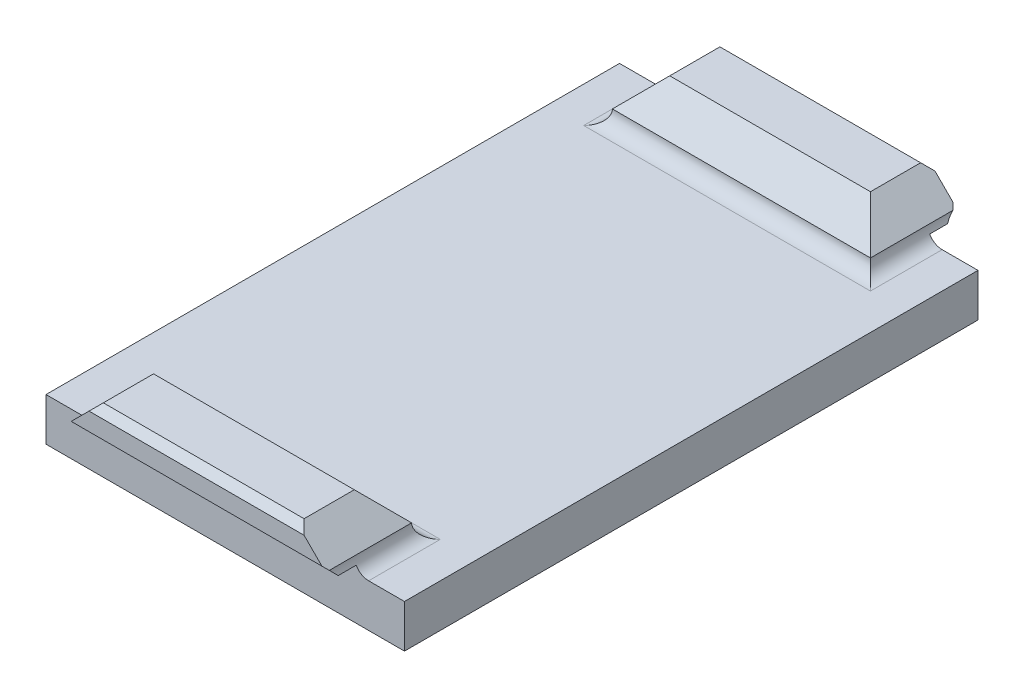
from build123d import *

# Parameters (mm, degrees)
SKETCH_1_W      = 25
SKETCH_1_H      = 3
EXTRUDE_1_DEPTH = 20
SKETCH_2_W      = 18
SKETCH_2_H      = 4
EXTRUDE_2_DEPTH = 3
EXTRUDE_3_DEPTH = 2
CHAMFER_1_SIZE  = 0.75
CHAMFER_2_SIZE  = 0.5
CHAMFER_3_SIZE  = 2
CHAMFER1_SIZE   = 2
FILLET1_R       = 1


with BuildPart() as part:
    # Эскиз1 → Бобышка-Вытянуть1 (new body)
    with BuildSketch(Plane.XY):
        with Locations((-4.579529598, 16.89)):
            Rectangle(SKETCH_1_W, SKETCH_1_H)
    extrude(amount=EXTRUDE_1_DEPTH)

    # Эскиз2 → Бобышка-Вытянуть2 (add)
    with BuildSketch(Plane(origin=(0, 18.39, 0), x_dir=(1, 0, 0), z_dir=(0, 1, 0))):
        with Locations((-4.579529598, -2)):
            Rectangle(SKETCH_2_W, SKETCH_2_H)
    extrude(amount=EXTRUDE_2_DEPTH)

    # Эскиз3 → Бобышка-Вытянуть3 (add)
    with BuildSketch(Plane(origin=(0, 0, 0), x_dir=(-1, 0, 0), z_dir=(0, 0, -1))):
        Polygon((-4.420470402, 21.39), (13.579529598, 21.39), (13.579529598, 19.89), (13.579529598, 18.896471803), (-4.420470402, 18.896471803), (-4.420470402, 19.89), align=None)
    extrude(amount=EXTRUDE_3_DEPTH)

    # Фаска1
    chamfer_1_edges = [part.edges().sort_by_distance(p)[0] for p in [
        (-4.579529598, 18.896471803, -2),
    ]]
    chamfer(chamfer_1_edges, length=CHAMFER_1_SIZE)

    # Фаска2
    chamfer_2_edges = [part.edges().sort_by_distance(p)[0] for p in [
        (-4.579529598, 21.39, -2),
    ]]
    chamfer(chamfer_2_edges, length=CHAMFER_2_SIZE)

    # Фаска3
    chamfer_3_edges = [part.edges().sort_by_distance(p)[0] for p in [
        (-4.579529598, 21.39, 4),
    ]]
    chamfer(chamfer_3_edges, length=CHAMFER_3_SIZE)

    # Зеркальное отражение1: part across plane


with BuildPart() as part_1:
    add(part.part)
    add(part.part.mirror(Plane.XY.offset(20)))

    # Chamfer1
    chamfer1_edges = [part_1.edges().sort_by_distance(p)[0] for p in [
        (4.420470402, 21.39, 39.75),
        (-13.579529598, 21.39, 39.75),
        (4.420470402, 21.39, 0.25),
        (-13.579529598, 21.39, 0.25),
    ]]
    chamfer(chamfer1_edges, length=CHAMFER1_SIZE)

    # Fillet1
    # the kernel refuses this fillet: 1 mm, written as the material it adds along each edge
    with BuildSketch(Plane(origin=(-13.579529598, 18.39, 6.5), x_dir=(-1, 0, 0), z_dir=(0, 0, -1))) as fillet1_piece_1_section:
        with BuildLine():
            CenterArc((FILLET1_R, FILLET1_R), FILLET1_R, 180, 90)
            Line((0, FILLET1_R), (0, 0))
            Line((0, 0), (FILLET1_R, 0))
        make_face()
    fillet1_piece_1 = extrude(amount=6.5, mode=Mode.PRIVATE)
    fillet1_piece_1 = split(fillet1_piece_1, bisect_by=Plane(origin=(-13.579529598, 17.64, 5.75), z_dir=(0, -0.7071067811865476, -0.7071067811865476)), keep=Keep.TOP, mode=Mode.PRIVATE)
    fillet1_piece_1 = fillet1_piece_1 - Plane(origin=(-13.579529598, 19.39, 5), x_dir=(0, 0, -1), z_dir=(1, 0, 0)) * Cylinder(1, 17, mode=Mode.PRIVATE)
    add(fillet1_piece_1)
    with BuildSketch(Plane(origin=(-13.579529598, 18.39, 6.5), x_dir=(-1, 0, 0), z_dir=(0, 0, -1))) as fillet1_piece_2_section:
        with BuildLine():
            CenterArc((FILLET1_R, FILLET1_R), FILLET1_R, 180, 90)
            Line((0, FILLET1_R), (0, 0))
            Line((0, 0), (FILLET1_R, 0))
        make_face()
    fillet1_piece_2 = extrude(amount=9, mode=Mode.PRIVATE)
    fillet1_piece_2 = split(fillet1_piece_2, bisect_by=Plane(origin=(-13.579529598, 14.768235901, 2.878235901), z_dir=(0, 0.7071067811865476, 0.7071067811865476)), keep=Keep.TOP, mode=Mode.PRIVATE)
    fillet1_piece_2 = split(fillet1_piece_2, bisect_by=Plane(origin=(-13.579529598, 18.896471803, 6.5), z_dir=(0, 1, 0)), keep=Keep.TOP, mode=Mode.PRIVATE)
    fillet1_piece_2 = split(fillet1_piece_2, bisect_by=Plane(origin=(-13.579529598, 18.39, 0), z_dir=(0, 0, -1)), keep=Keep.TOP, mode=Mode.PRIVATE)
    add(fillet1_piece_2)
    with BuildSketch(Plane(origin=(6.920470402, 18.39, 4), x_dir=(0, 1, 0), z_dir=(-1, 0, 0))) as fillet1_piece_3_section:
        with BuildLine():
            CenterArc((FILLET1_R, -FILLET1_R), FILLET1_R, 90, 90)
            Line((0, -FILLET1_R), (0, 0))
            Line((0, 0), (FILLET1_R, 0))
        make_face()
    fillet1_piece_3 = extrude(amount=23, mode=Mode.PRIVATE)
    fillet1_piece_3 = split(fillet1_piece_3, bisect_by=Plane(origin=(6.170470402, 17.64, 4), z_dir=(-0.7071067811865476, -0.7071067811865476, 0)), keep=Keep.TOP, mode=Mode.PRIVATE)
    fillet1_piece_3 = split(fillet1_piece_3, bisect_by=Plane(origin=(-3.829529598, 29.14, 4), z_dir=(0.7071067811865476, -0.7071067811865476, 0)), keep=Keep.TOP, mode=Mode.PRIVATE)
    fillet1_piece_3 = fillet1_piece_3 - Plane(origin=(-14.579529598, 19.39, 4), x_dir=(0, -1, 0), z_dir=(0, 0, 1)) * Cylinder(1, 50, mode=Mode.PRIVATE)
    fillet1_piece_3 = fillet1_piece_3 - Plane(origin=(5.420470402, 19.39, 4), x_dir=(-1, 0, 0), z_dir=(0, 0, -1)) * Cylinder(1, 50, mode=Mode.PRIVATE)
    add(fillet1_piece_3)
    with BuildSketch(Plane(origin=(4.420470402, 18.39, -2.5), x_dir=(0, 1, 0), z_dir=(0, 0, 1))) as fillet1_piece_4_section:
        with BuildLine():
            CenterArc((FILLET1_R, -FILLET1_R), FILLET1_R, 90, 90)
            Line((0, -FILLET1_R), (0, 0))
            Line((0, 0), (FILLET1_R, 0))
        make_face()
    fillet1_piece_4 = extrude(amount=9, mode=Mode.PRIVATE)
    fillet1_piece_4 = split(fillet1_piece_4, bisect_by=Plane(origin=(4.420470402, 19.268235901, -1.621764099), z_dir=(0, 0.7071067811865476, 0.7071067811865476)), keep=Keep.TOP, mode=Mode.PRIVATE)
    fillet1_piece_4 = split(fillet1_piece_4, bisect_by=Plane(origin=(4.420470402, 18.896471803, -2.5), z_dir=(0, 1, 0)), keep=Keep.TOP, mode=Mode.PRIVATE)
    fillet1_piece_4 = split(fillet1_piece_4, bisect_by=Plane(origin=(4.420470402, 22.14, 1.25), z_dir=(0, -0.7071067811865476, -0.7071067811865476)), keep=Keep.TOP, mode=Mode.PRIVATE)
    fillet1_piece_4 = fillet1_piece_4 - Plane(origin=(4.420470402, 19.39, 5), x_dir=(0, 0, -1), z_dir=(1, 0, 0)) * Cylinder(1, 22, mode=Mode.PRIVATE)
    add(fillet1_piece_4)
    with BuildSketch(Plane(origin=(4.420470402, 18.39, 0), x_dir=(0, 1, 0), z_dir=(0, 0, 1))) as fillet1_piece_5_section:
        with BuildLine():
            CenterArc((FILLET1_R, -FILLET1_R), FILLET1_R, 90, 90)
            Line((0, -FILLET1_R), (0, 0))
            Line((0, 0), (FILLET1_R, 0))
        make_face()
    fillet1_piece_5 = extrude(amount=6.5, mode=Mode.PRIVATE)
    fillet1_piece_5 = split(fillet1_piece_5, bisect_by=Plane(origin=(4.420470402, 20.89, 2.5), z_dir=(0, -0.7071067811865476, -0.7071067811865476)), keep=Keep.TOP, mode=Mode.PRIVATE)
    fillet1_piece_5 = fillet1_piece_5 - Plane(origin=(4.420470402, 19.39, 5), x_dir=(0, 0, -1), z_dir=(1, 0, 0)) * Cylinder(1, 17, mode=Mode.PRIVATE)
    add(fillet1_piece_5)
    with BuildSketch(Plane(origin=(-13.579529598, 18.39, 33.5), x_dir=(-1, 0, 0), z_dir=(0, 0, 1))) as fillet1_piece_6_section:
        with BuildLine():
            CenterArc((FILLET1_R, -FILLET1_R), FILLET1_R, 90, 90)
            Line((0, -FILLET1_R), (0, 0))
            Line((0, 0), (FILLET1_R, 0))
        make_face()
    fillet1_piece_6 = extrude(amount=6.5, mode=Mode.PRIVATE)
    fillet1_piece_6 = split(fillet1_piece_6, bisect_by=Plane(origin=(-13.579529598, 17.64, 34.25), z_dir=(0, -0.7071067811865476, 0.7071067811865476)), keep=Keep.TOP, mode=Mode.PRIVATE)
    fillet1_piece_6 = fillet1_piece_6 - Plane(origin=(-13.579529598, 19.39, 35), x_dir=(0, -1, 0), z_dir=(1, 0, 0)) * Cylinder(1, 17, mode=Mode.PRIVATE)
    add(fillet1_piece_6)
    with BuildSketch(Plane(origin=(-13.579529598, 18.39, 36), x_dir=(-1, 0, 0), z_dir=(0, 0, 1))) as fillet1_piece_7_section:
        with BuildLine():
            CenterArc((FILLET1_R, -FILLET1_R), FILLET1_R, 90, 90)
            Line((0, -FILLET1_R), (0, 0))
            Line((0, 0), (FILLET1_R, 0))
        make_face()
    fillet1_piece_7 = extrude(amount=6.5, mode=Mode.PRIVATE)
    fillet1_piece_7 = split(fillet1_piece_7, bisect_by=Plane(origin=(-13.579529598, 18.896471803, 36), z_dir=(0, 1, 0)), keep=Keep.TOP, mode=Mode.PRIVATE)
    fillet1_piece_7 = split(fillet1_piece_7, bisect_by=Plane(origin=(-13.579529598, 16.018235901, 38.371764099), z_dir=(0, 0.7071067811865476, -0.7071067811865476)), keep=Keep.TOP, mode=Mode.PRIVATE)
    add(fillet1_piece_7)
    with BuildSketch(Plane(origin=(6.920470402, 18.39, 36), x_dir=(0, 0, -1), z_dir=(-1, 0, 0))) as fillet1_piece_8_section:
        with BuildLine():
            CenterArc((FILLET1_R, -FILLET1_R), FILLET1_R, 90, 90)
            Line((0, -FILLET1_R), (0, 0))
            Line((0, 0), (FILLET1_R, 0))
        make_face()
    fillet1_piece_8 = extrude(amount=23, mode=Mode.PRIVATE)
    fillet1_piece_8 = split(fillet1_piece_8, bisect_by=Plane(origin=(-3.829529598, 29.14, 36), z_dir=(0.7071067811865476, -0.7071067811865476, 0)), keep=Keep.TOP, mode=Mode.PRIVATE)
    fillet1_piece_8 = split(fillet1_piece_8, bisect_by=Plane(origin=(6.170470402, 17.64, 36), z_dir=(-0.7071067811865476, -0.7071067811865476, 0)), keep=Keep.TOP, mode=Mode.PRIVATE)
    fillet1_piece_8 = fillet1_piece_8 - Plane(origin=(-14.579529598, 19.39, 36), x_dir=(0, -1, 0), z_dir=(0, 0, -1)) * Cylinder(1, 50, mode=Mode.PRIVATE)
    fillet1_piece_8 = fillet1_piece_8 - Plane(origin=(5.420470402, 19.39, 36), x_dir=(0, -1, 0), z_dir=(0, 0, 1)) * Cylinder(1, 50, mode=Mode.PRIVATE)
    add(fillet1_piece_8)
    with BuildSketch(Plane(origin=(4.420470402, 18.39, 42.5), x_dir=(1, 0, 0), z_dir=(0, 0, -1))) as fillet1_piece_9_section:
        with BuildLine():
            CenterArc((FILLET1_R, -FILLET1_R), FILLET1_R, 90, 90)
            Line((0, -FILLET1_R), (0, 0))
            Line((0, 0), (FILLET1_R, 0))
        make_face()
    fillet1_piece_9 = extrude(amount=9, mode=Mode.PRIVATE)
    fillet1_piece_9 = split(fillet1_piece_9, bisect_by=Plane(origin=(4.420470402, 18.896471803, 42.5), z_dir=(0, 1, 0)), keep=Keep.TOP, mode=Mode.PRIVATE)
    fillet1_piece_9 = split(fillet1_piece_9, bisect_by=Plane(origin=(4.420470402, 19.268235901, 41.621764099), z_dir=(0, 0.7071067811865476, -0.7071067811865476)), keep=Keep.TOP, mode=Mode.PRIVATE)
    fillet1_piece_9 = split(fillet1_piece_9, bisect_by=Plane(origin=(4.420470402, 22.14, 38.75), z_dir=(0, -0.7071067811865476, 0.7071067811865476)), keep=Keep.TOP, mode=Mode.PRIVATE)
    fillet1_piece_9 = fillet1_piece_9 - Plane(origin=(4.420470402, 19.39, 35), x_dir=(0, -1, 0), z_dir=(1, 0, 0)) * Cylinder(1, 22, mode=Mode.PRIVATE)
    add(fillet1_piece_9)
    with BuildSketch(Plane(origin=(4.420470402, 18.39, 40), x_dir=(1, 0, 0), z_dir=(0, 0, -1))) as fillet1_piece_10_section:
        with BuildLine():
            CenterArc((FILLET1_R, -FILLET1_R), FILLET1_R, 90, 90)
            Line((0, -FILLET1_R), (0, 0))
            Line((0, 0), (FILLET1_R, 0))
        make_face()
    fillet1_piece_10 = extrude(amount=6.5, mode=Mode.PRIVATE)
    fillet1_piece_10 = split(fillet1_piece_10, bisect_by=Plane(origin=(4.420470402, 20.89, 37.5), z_dir=(0, -0.7071067811865476, 0.7071067811865476)), keep=Keep.TOP, mode=Mode.PRIVATE)
    fillet1_piece_10 = fillet1_piece_10 - Plane(origin=(4.420470402, 19.39, 35), x_dir=(0, -1, 0), z_dir=(1, 0, 0)) * Cylinder(1, 17, mode=Mode.PRIVATE)
    add(fillet1_piece_10)


solid = part_1.part
